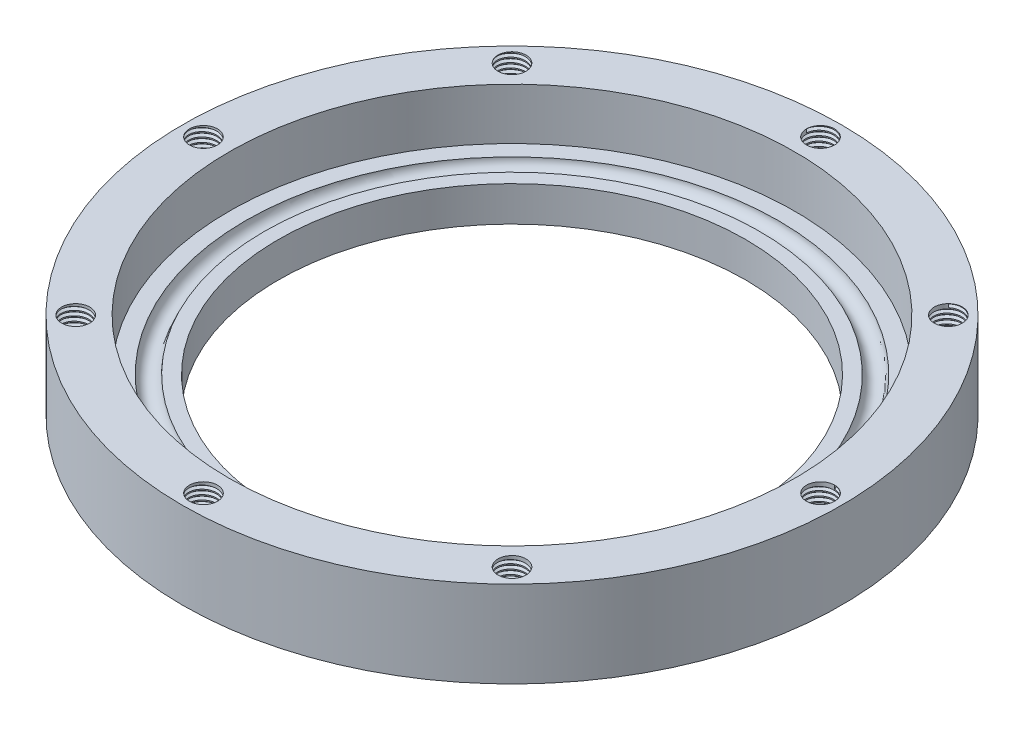
from build123d import *

# Parameters (mm, degrees)
SKETCH2_R           = 70.5
SKETCH2_R_2         = 60.5
BOSS_EXTRUDE3_DEPTH = 11
BOSS_EXTRUDE4_START = 7.5
SKETCH3_R           = 70.5
SKETCH3_R_2         = 50
BOSS_EXTRUDE4_DEPTH = 7.5
SKETCH4_R           = 3
CUT_EXTRUDE1_DEPTH  = 5
THREAD1_PITCH       = 1
CIRPATTERN1_COUNT   = 8
SKETCH5_R           = 2


with BuildPart() as part:
    # Sketch2 → Boss-Extrude3 (new body)
    with BuildSketch(Plane(origin=(0, 0, 0), x_dir=(1, 0, 0), z_dir=(0, 1, 0))):
        with Locations(Location((0, 0, 0), (0, 0, 270))):
            Circle(SKETCH2_R)
        with Locations(Location((0, 0, 0), (0, 0, 270))):
            Circle(SKETCH2_R_2, mode=Mode.SUBTRACT)
    extrude(amount=BOSS_EXTRUDE3_DEPTH)

    # Sketch3 → Boss-Extrude4 (add)
    with BuildSketch(Plane.XZ.offset(BOSS_EXTRUDE4_START)):
        with Locations(Location((0, 0, 0), (0, 0, 270))):
            Circle(SKETCH3_R)
        with Locations(Location((0, 0, 0), (0, 0, 270))):
            Circle(SKETCH3_R_2, mode=Mode.SUBTRACT)
    extrude(amount=-BOSS_EXTRUDE4_DEPTH)

    # Sketch4 → Cut-Extrude1 (cut)
    with BuildSketch(Plane(origin=(0, 11, 0), x_dir=(1, 0, 0), z_dir=(0, 1, 0))):
        with Locations(Location((0, 66, 0), (0, 0, 270))):
            Circle(SKETCH4_R)
        with Locations(Location((46.669047558, 46.669047558, 0), (0, 0, 270))):
            Circle(SKETCH4_R)
        with Locations(Location((66, 0, 0), (0, 0, 270))):
            Circle(SKETCH4_R)
        with Locations(Location((46.669047558, -46.669047558, 0), (0, 0, 270))):
            Circle(SKETCH4_R)
        with Locations(Location((0, -66, 0), (0, 0, 270))):
            Circle(SKETCH4_R)
        with Locations(Location((-46.669047558, -46.669047558, 0), (0, 0, 270))):
            Circle(SKETCH4_R)
        with Locations(Location((-66, 0, 0), (0, 0, 270))):
            Circle(SKETCH4_R)
        with Locations(Location((-46.669047558, 46.669047558, 0), (0, 0, 270))):
            Circle(SKETCH4_R)
    extrude(amount=-CUT_EXTRUDE1_DEPTH, mode=Mode.SUBTRACT)

    # Thread1: arcs per turn and ends read off the stored shape
    # Thread1: the profile of Thread Profile1 profile screwed along a right-hand helix through 5 turns, 8 arcs to a turn; built about Z, then put on its axis
    thread1_z = Axis((0, 0, 0), (0, 0, 1))
    thread1_corners = [(2.9997, 0, -0.000173205), (3.541265875, 0, 0.312499999), (3.541265875, 0, 0.437499999), (2.9997, 0, 0.750173202)]
    with BuildLine(mode=Mode.PRIVATE) as thread1_profile:
        Line(thread1_corners[0], thread1_corners[1])
        Line(thread1_corners[1], thread1_corners[2])
        Line(thread1_corners[2], thread1_corners[3])
        Line(thread1_corners[3], thread1_corners[0])
    thread1_cap = Face(thread1_profile.wire())
    thread1_turn_angles = [0, 22.5, 45, 67.5, 90, 112.5, 135, 157.5, 180, 202.5, 225, 247.5, 270, 292.5, 315, 337.5, 360]
    thread1_turn_weights = [1, 0.9238795325112867, 1, 0.9238795325112867, 1, 0.9238795325112867, 1, 0.9238795325112867, 1, 0.9238795325112867, 1, 0.9238795325112867, 1, 0.9238795325112867, 1, 0.9238795325112867, 1]
    thread1_turn_rails = [Edge.make_bspline([Vector(p[0], p[1], 0).rotate(thread1_z, thread1_turn_angles[k]) / thread1_turn_weights[k] + Vector(0, 0, p[2] + THREAD1_PITCH * thread1_turn_angles[k] / 360) for k in range(17)], [0, 0, 0, 1, 1, 2, 2, 3, 3, 4, 4, 5, 5, 6, 6, 7, 7, 8, 8, 8], 2, thread1_turn_weights) for p in thread1_corners]
    thread1_turn_sides = [Face.make_surface_from_curves(thread1_turn_rails[p[0]], thread1_turn_rails[p[1]]) for p in [(0, 1), (1, 2), (2, 3), (3, 0)]]
    thread1 = Plane(origin=(0, 11, -66), x_dir=(-1, 0, 0), z_dir=(0, -1, 0)) * Solid(Shell([*[p.moved(Location((0, 0, THREAD1_PITCH * i))) for i in range(5) for p in thread1_turn_sides], thread1_cap, thread1_cap.rotate(thread1_z, 1800).moved(Location((0, 0, THREAD1_PITCH * 1800 / 360)))]))
    add(thread1, mode=Mode.SUBTRACT)

    # CirPattern1: Thread1 ×8 about axis
    cirpattern1_axis = Axis((0, 0, 0), (0, -1, 0))
    for i in range(1, CIRPATTERN1_COUNT):
        add(thread1.rotate(cirpattern1_axis, i * 360 / CIRPATTERN1_COUNT), mode=Mode.SUBTRACT)

    # Cut-Sweep1: sweep along a path in Sketch6
    with BuildLine(Plane(origin=(0, 0, 0), x_dir=(1, 0, 0), z_dir=(0, 1, 0))) as cut_sweep1_path:
        CenterArc((0, 0), 55, 0, 360)
    # Sketch5 → Cut-Sweep1 (sweep, cut)
    with BuildSketch(Plane.XY):
        with Locations((-55, 0)):
            Circle(SKETCH5_R)
    sweep(path=cut_sweep1_path.line, mode=Mode.SUBTRACT)


solid = part.part
